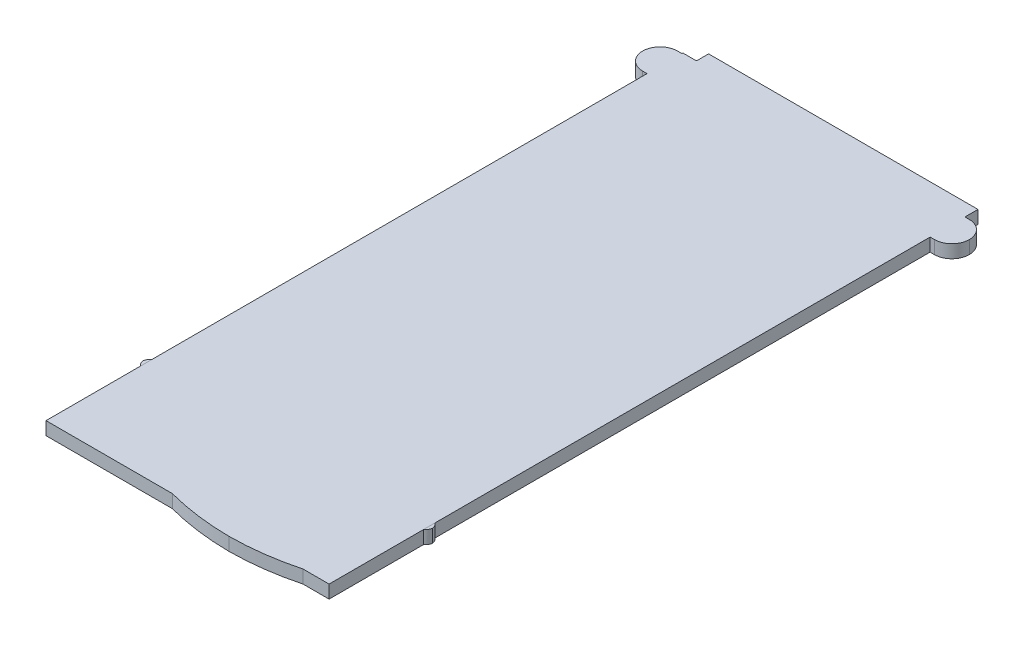
from build123d import *

# Parameters (mm, degrees)
CROQUIS1_W               = 65
CROQUIS1_H               = 146
SALIENTE_EXTRUIR1_DEPTH  = 3
CROQUIS2_W               = 8
CROQUIS2_H               = 3
SALIENTE_EXTRUIR2_DEPTH  = 5
REDONDEO1_R              = 4
REDONDEO1_OF_SIMETR_A1_R = 4
CROQUIS3_W               = 2.60095456
CROQUIS3_H               = 3.001101416
SALIENTE_EXTRUIR3_DEPTH  = 0.8
REDONDEO2_R              = 2
REDONDEO2_OF_SIMETR_A5_R = 2
CROQUIS4_W               = 65
CROQUIS4_H               = 3
CROQUIS4_W_2             = 30
CROQUIS4_H_2             = 2
SALIENTE_EXTRUIR4_DEPTH  = 3
REDONDEO3_R              = 60
CROQUIS6_W               = 3.139643751
CROQUIS6_H               = 2.781946526
CORTAR_EXTRUIR1_DEPTH    = 10


# Some blends are built 0.0001 mm under size
with BuildPart() as part:
    # Croquis1 → Saliente-Extruir1 (new body)
    with BuildSketch(Plane(origin=(0, 0, 0), x_dir=(1, 0, 0), z_dir=(0, 1, 0))):
        Rectangle(CROQUIS1_W, CROQUIS1_H)
    extrude(amount=SALIENTE_EXTRUIR1_DEPTH)

    # Croquis2 → Saliente-Extruir2 (add)
    with BuildSketch(Plane(origin=(32.5, 0, 0), x_dir=(0, 0, -1), z_dir=(1, 0, 0))):
        with Locations((66, 1.5)):
            Rectangle(CROQUIS2_W, CROQUIS2_H)
    saliente_extruir2 = extrude(amount=SALIENTE_EXTRUIR2_DEPTH)

    # Redondeo1
    redondeo1_edges = [part.edges().sort_by_distance(p)[0] for p in [
        (37.5, 1.5, -62),
        (37.5, 1.5, -70),
    ]]
    fillet(redondeo1_edges, radius=REDONDEO1_R - 0.0001)  # a hair under: the kernel refuses the full size

    # Simetría1: Saliente-Extruir2 across plane
    add(saliente_extruir2.mirror(Plane(origin=(0, 0, 0), x_dir=(0, 0, 1), z_dir=(1, 0, 0))))

    # Redondeo1 of Simetría1
    redondeo1_of_simetr_a1_edges = [part.edges().sort_by_distance(p)[0] for p in [
        (-37.5, 1.5, -62),
        (-37.5, 1.5, -70),
    ]]
    fillet(redondeo1_of_simetr_a1_edges, radius=REDONDEO1_OF_SIMETR_A1_R - 0.0001)  # a hair under: the kernel refuses the full size

    # Croquis3 → Saliente-Extruir3 (add)
    with BuildSketch(Plane(origin=(32.5, 0, 0), x_dir=(0, 0, -1), z_dir=(1, 0, 0))):
        with Locations((-53.003039433, 1.500550708)):
            Rectangle(CROQUIS3_W, CROQUIS3_H)
    saliente_extruir3 = extrude(amount=SALIENTE_EXTRUIR3_DEPTH)

    # Redondeo2
    # the kernel refuses this fillet: 2 mm, written as the material it takes off along each edge
    with BuildSketch(Plane(origin=(33.3, 7.001101416, 51.702562153), x_dir=(-1, 0, 0), z_dir=(0, -1, 0)), Plane(origin=(33.3, -4, 54.303516713), x_dir=(-1, 0, 0), z_dir=(0, 1, 0))) as redondeo2_piece_1:
        with BuildLine():
            CenterArc((2, -1.6), REDONDEO2_R, 126.869897646, 53.130102354)
            Line((0, -1.6), (-0.04, -1.6))
            Line((-0.04, -1.6), (-0.04, 0))
            Line((-0.04, 0), (0, 0.04))
            ThreePointArc((0, 0.04), (0.4, 0.04), (0.776, 0.032))
            Line((0.776, 0.032), (0.8, 0))
        make_face()
    extrude(amount=11.001101416, mode=Mode.SUBTRACT)

    # Simetría5: Saliente-Extruir3 across plane
    add(saliente_extruir3.mirror(Plane(origin=(0, 0, 0), x_dir=(0, 0, 1), z_dir=(1, 0, 0))))

    # Redondeo2 of Simetría5
    # the kernel refuses this fillet: 2 mm, written as the material it takes off along each edge
    with BuildSketch(Plane(origin=(-33.3, 7.001101416, 51.702562153), x_dir=(1, 0, 0), z_dir=(0, -1, 0)), Plane(origin=(-33.3, -4, 54.303516713), x_dir=(1, 0, 0), z_dir=(0, 1, 0))) as redondeo2_of_simetr_a5_piece_1:
        with BuildLine():
            CenterArc((2, 1.6), REDONDEO2_OF_SIMETR_A5_R, 180, 53.130102354)
            Line((0, 1.6), (-0.04, 1.6))
            Line((-0.04, 1.6), (-0.04, 0))
            Line((-0.04, 0), (0, -0.04))
            ThreePointArc((0, -0.04), (0.4, -0.04), (0.776, -0.032))
            Line((0.776, -0.032), (0.8, 0))
        make_face()
    extrude(amount=11.001101416, mode=Mode.SUBTRACT)

    # Croquis4 → Saliente-Extruir4 (add)
    with BuildSketch(Plane(origin=(0, 3, 0), x_dir=(1, 0, 0), z_dir=(0, 1, 0))):
        with Locations((0, -74.5)):
            Rectangle(CROQUIS4_W, CROQUIS4_H)
        with Locations((11.5, -77)):
            Rectangle(CROQUIS4_W_2, CROQUIS4_H_2)
    extrude(amount=-SALIENTE_EXTRUIR4_DEPTH)

    # Redondeo3
    # the kernel refuses this fillet: 60 mm, written as the material it takes off along each edge
    with BuildSketch(Plane(origin=(26.5, 41.405728739, 78), x_dir=(0, 0, -1), z_dir=(0, -1, 0))) as redondeo3_piece_1:
        with BuildLine():
            CenterArc((60, -15.362291496), REDONDEO3_R, 165.164888418, 14.835111582)
            Line((0, -15.362291496), (0, 0))
            Line((0, 0), (2, 0))
        make_face()
    extrude(amount=79.811457479, mode=Mode.SUBTRACT)
    with BuildSketch(Plane(origin=(-3.5, 41.405728739, 78), x_dir=(1, 0, 0), z_dir=(0, -1, 0))) as redondeo3_piece_2:
        with BuildLine():
            CenterArc((15.362291496, -60), REDONDEO3_R, 90, 14.835111582)
            Line((0, -2), (0, 0))
            Line((0, 0), (15.362291496, 0))
        make_face()
    extrude(amount=79.811457479, mode=Mode.SUBTRACT)

    # Croquis6 → Cortar-Extruir1 (cut)
    with BuildSketch(Plane(origin=(0, 3, 0), x_dir=(1, 0, 0), z_dir=(0, 1, 0))):
        with Locations((-30.930178125, 71.609026737)):
            Rectangle(CROQUIS6_W, CROQUIS6_H)
    extrude(amount=-CORTAR_EXTRUIR1_DEPTH, mode=Mode.SUBTRACT)


solid = part.part
